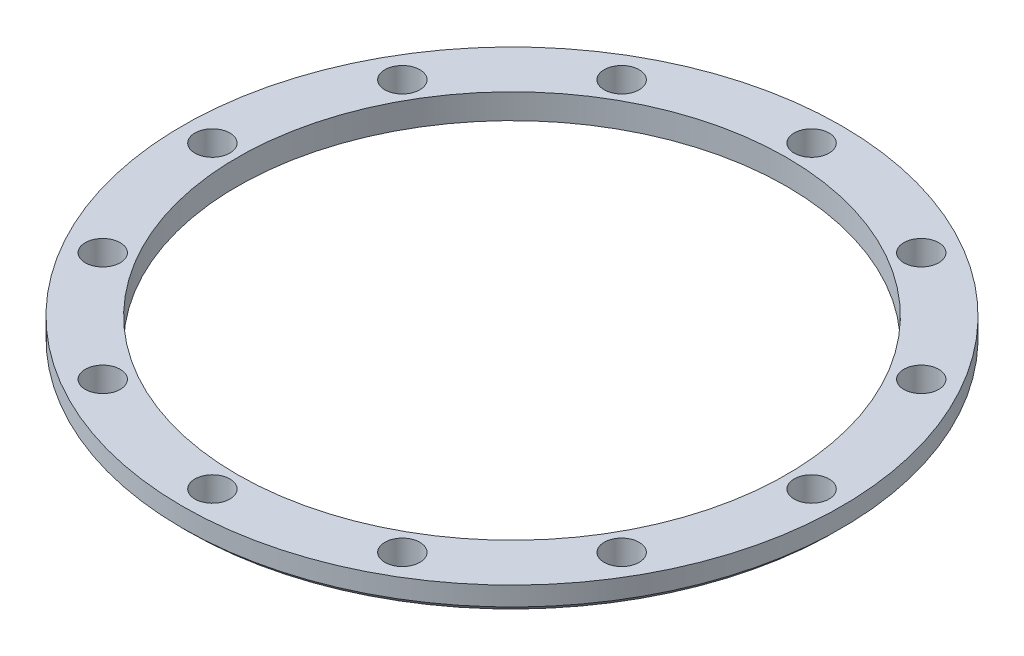
from build123d import *

# Parameters (mm, degrees)
BASISTEIL_BECHER_1_START       = -43
BASISTEIL_BECHER_1_OUTLINE_R   = 32.5
BASISTEIL_BECHER_1_OUTLINE_R_2 = 1.75
BASISTEIL_BECHER_1_OUTLINE_R_3 = 27.5
BASISTEIL_BECHER_1_DEPTH       = 3
CUT_EXTRUDE1_START             = -0.5
SKETCH1_R                      = 32.5
CUT_EXTRUDE1_DEPTH             = 0.5
BOSS_EXTRUDE1_START            = -2.5
SKETCH3_R                      = 33
SKETCH3_R_2                    = 32.5
BOSS_EXTRUDE1_DEPTH            = 2.5
CHAMFER1_SIZE                  = 0.6


# Read off the part's stored shape, not the designer's step: Basisteil-Becher-1
with BuildPart() as part:
    # Basisteil-Becher-1 outline → Basisteil-Becher-1 (new body)
    with BuildSketch(Plane(origin=(0, 0, 0), x_dir=(1, 0, 0), z_dir=(0, 1, 0)).offset(BASISTEIL_BECHER_1_START)):
        Circle(BASISTEIL_BECHER_1_OUTLINE_R)
        with Locations((-15, -25.980762114)):
            Circle(BASISTEIL_BECHER_1_OUTLINE_R_2, mode=Mode.SUBTRACT)
        with Locations((-25.980762114, -15)):
            Circle(BASISTEIL_BECHER_1_OUTLINE_R_2, mode=Mode.SUBTRACT)
        with Locations((0, -30)):
            Circle(BASISTEIL_BECHER_1_OUTLINE_R_2, mode=Mode.SUBTRACT)
        with Locations((15, -25.980762114)):
            Circle(BASISTEIL_BECHER_1_OUTLINE_R_2, mode=Mode.SUBTRACT)
        with Locations((25.980762114, -15)):
            Circle(BASISTEIL_BECHER_1_OUTLINE_R_2, mode=Mode.SUBTRACT)
        with Locations((-30, 0)):
            Circle(BASISTEIL_BECHER_1_OUTLINE_R_2, mode=Mode.SUBTRACT)
        with Locations((-25.980762114, 15)):
            Circle(BASISTEIL_BECHER_1_OUTLINE_R_2, mode=Mode.SUBTRACT)
        with Locations((-15, 25.980762114)):
            Circle(BASISTEIL_BECHER_1_OUTLINE_R_2, mode=Mode.SUBTRACT)
        Circle(BASISTEIL_BECHER_1_OUTLINE_R_3, mode=Mode.SUBTRACT)
        with Locations((30, 0)):
            Circle(BASISTEIL_BECHER_1_OUTLINE_R_2, mode=Mode.SUBTRACT)
        with Locations((25.980762114, 15)):
            Circle(BASISTEIL_BECHER_1_OUTLINE_R_2, mode=Mode.SUBTRACT)
        with Locations((0, 30)):
            Circle(BASISTEIL_BECHER_1_OUTLINE_R_2, mode=Mode.SUBTRACT)
        with Locations((15, 25.980762114)):
            Circle(BASISTEIL_BECHER_1_OUTLINE_R_2, mode=Mode.SUBTRACT)
    extrude(amount=BASISTEIL_BECHER_1_DEPTH)

    # Sketch1 → Cut-Extrude1 (cut)
    with BuildSketch(Plane(origin=(0, -40, 0), x_dir=(1, 0, 0), z_dir=(0, 1, 0)).offset(CUT_EXTRUDE1_START)):
        with Locations(Location((0, 0, 0), (0, 0, 270))):
            Circle(SKETCH1_R)
    extrude(amount=CUT_EXTRUDE1_DEPTH, mode=Mode.SUBTRACT)

    # Sketch3 → Boss-Extrude1 (add)
    with BuildSketch(Plane(origin=(0, -40.5, 0), x_dir=(1, 0, 0), z_dir=(0, 1, 0)).offset(BOSS_EXTRUDE1_START)):
        with Locations(Location((0, 0, 0), (0, 0, 270))):
            Circle(SKETCH3_R)
        Circle(SKETCH3_R_2, mode=Mode.SUBTRACT)
    extrude(amount=BOSS_EXTRUDE1_DEPTH)

    # Chamfer1
    chamfer1_edges = [part.edges().sort_by_distance(p)[0] for p in [
        (0, -43, -33),
    ]]
    chamfer(chamfer1_edges, length=CHAMFER1_SIZE)


solid = part.part
